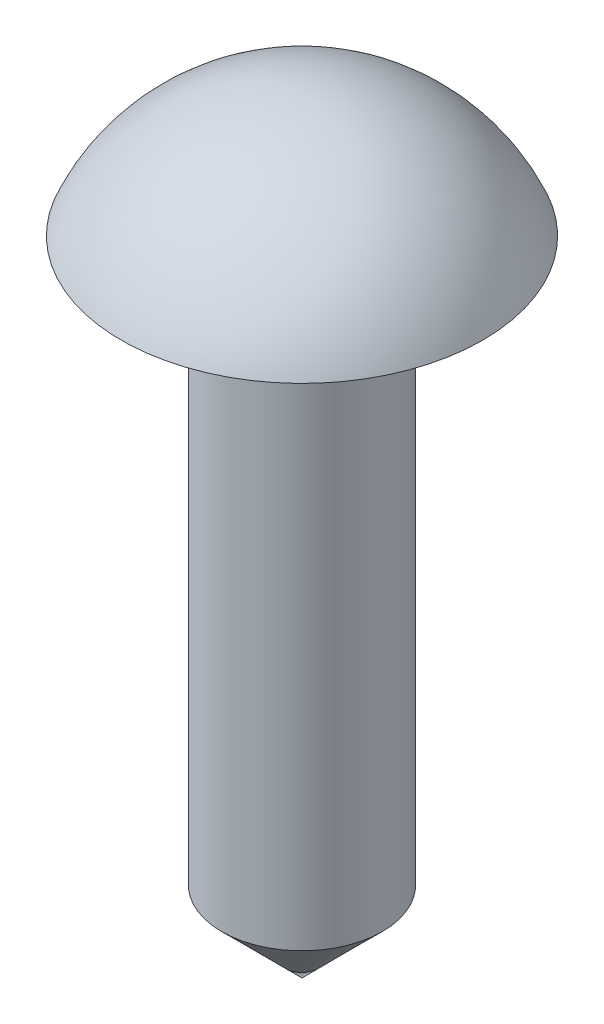
from build123d import *

# Parameters (mm, degrees)
CHAMFER1_SIZE = 1


with BuildPart() as part:
    # Sketch1 → Revolve1 (revolve)
    with BuildSketch(Plane.XY):
        with BuildLine():
            Line((0, -4), (1, -4))
            Line((1, -4), (1, 4))
            Line((1, 4), (2.25, 4))
            ThreePointArc((2.25, 4), (1.352081728, 5.090622592), (0, 5.5))
            Line((0, 5.5), (0, -4))
        make_face()
    revolve(axis=Axis((0, -593.724808214, 0), (0, 1, 0)))

    # Chamfer1
    chamfer1_edges = [part.edges().sort_by_distance(p)[0] for p in [
        (-1, -4, 0),
    ]]
    chamfer(chamfer1_edges, length=CHAMFER1_SIZE - 0.0001)  # a hair under: the kernel refuses the full size


solid = part.part
